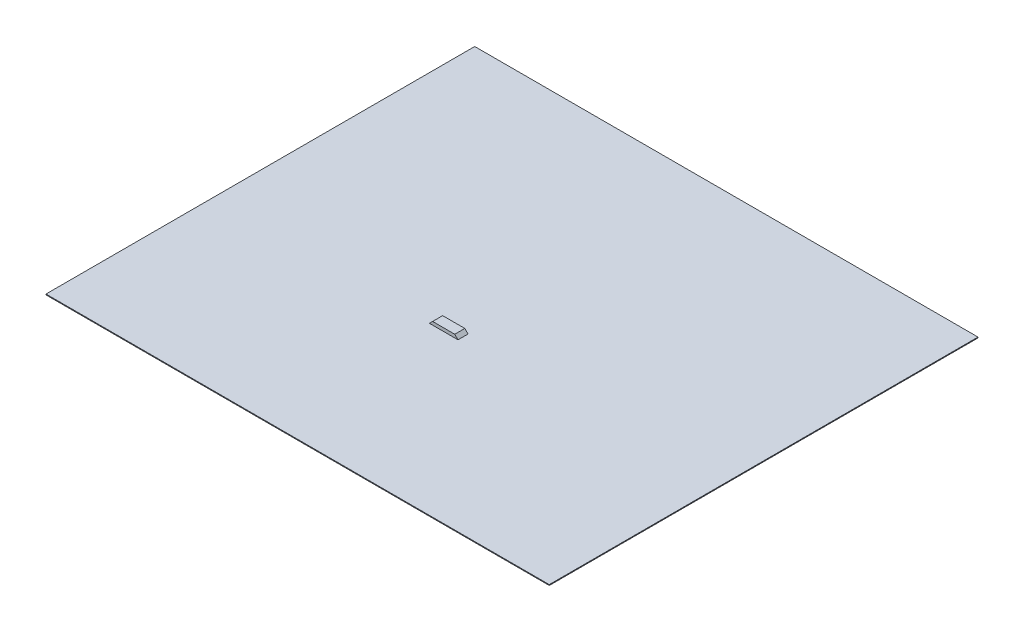
from build123d import *

# Parameters (mm, degrees)
SKETCH1_W           = 6236.428790575
SKETCH1_H           = 5312.431817201
BOSS_EXTRUDE1_DEPTH = 10
SKETCH2_W           = 354.470716076
SKETCH2_H           = 124.389132605
BOSS_EXTRUDE2_DEPTH = 40
CHAMFER1_SIZE       = 40


with BuildPart() as part:
    # Sketch1 → Boss-Extrude1 (new body)
    with BuildSketch(Plane(origin=(0, 0, 0), x_dir=(1, 0, 0), z_dir=(0, 1, 0))):
        with Locations((428.523573662, 470.824447086)):
            Rectangle(SKETCH1_W, SKETCH1_H)
    extrude(amount=BOSS_EXTRUDE1_DEPTH)

    # Sketch2 → Boss-Extrude2 (add)
    with BuildSketch(Plane(origin=(0, 10, 0), x_dir=(1, 0, 0), z_dir=(0, 1, 0))):
        with Locations((177.235358038, -62.194566303)):
            Rectangle(SKETCH2_W, SKETCH2_H)
    extrude(amount=BOSS_EXTRUDE2_DEPTH)

    # Chamfer1
    chamfer1_edges = [part.edges().sort_by_distance(p)[0] for p in [
        (354.470716076, 50, 62.194566303),
        (0, 50, 62.194566303),
    ]]
    chamfer(chamfer1_edges, length=CHAMFER1_SIZE - 0.0001)  # a hair under: the kernel refuses the full size


solid = part.part
